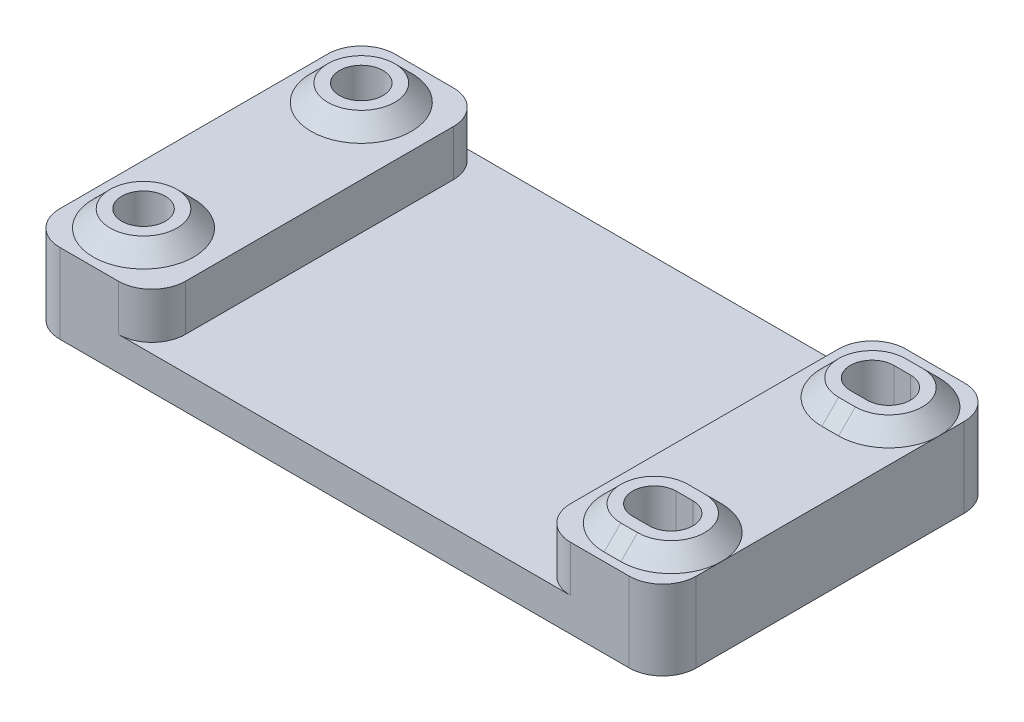
from build123d import *

# Parameters (mm, degrees)
SKETCH1_W           = 76
SKETCH1_H           = 40
SKETCH1_R           = 2.6
BOSS_EXTRUDE1_DEPTH = 4
SKETCH2_W           = 15
SKETCH2_H           = 40
SKETCH2_R           = 2.6
BOSS_EXTRUDE2_DEPTH = 5.5
SKETCH3_R           = 4
SKETCH3_R_2         = 2.6
BOSS_EXTRUDE3_DEPTH = 2
CHAMFER1_SIZE       = 2
FILLET1_R           = 4


with BuildPart() as part:
    # Sketch1 → Boss-Extrude1 (new body)
    with BuildSketch(Plane(origin=(0, 0, 0), x_dir=(1, 0, 0), z_dir=(0, 1, 0))):
        Rectangle(SKETCH1_W, SKETCH1_H)
        with Locations(Location((-31, -13, 0), (0, 0, 270))):
            Circle(SKETCH1_R, mode=Mode.SUBTRACT)
        with Locations(Location((-31, 13, 0), (0, 0, 270))):
            Circle(SKETCH1_R, mode=Mode.SUBTRACT)
        with BuildLine():
            Line((30, 15.6), (32, 15.6))
            ThreePointArc((32, 15.6), (34.6, 13), (32, 10.4))
            Line((32, 10.4), (30, 10.4))
            ThreePointArc((30, 10.4), (27.4, 13), (30, 15.6))
        make_face(mode=Mode.SUBTRACT)
        with BuildLine():
            Line((32, -10.4), (30, -10.4))
            ThreePointArc((30, -10.4), (27.4, -13), (30, -15.6))
            Line((30, -15.6), (32, -15.6))
            ThreePointArc((32, -15.6), (34.6, -13), (32, -10.4))
        make_face(mode=Mode.SUBTRACT)
    extrude(amount=BOSS_EXTRUDE1_DEPTH)

    # Sketch2 → Boss-Extrude2 (add)
    # profile 1 of 2: a face of its own
    with BuildSketch(Plane(origin=(0, 4, 0), x_dir=(1, 0, 0), z_dir=(0, 1, 0))):
        with Locations((30.5, 0)):
            Rectangle(SKETCH2_W, SKETCH2_H)
        with BuildLine():
            ThreePointArc((30, -15.6), (27.4, -13), (30, -10.4))
            Line((30, -10.4), (32, -10.4))
            ThreePointArc((32, -10.4), (34.6, -13), (32, -15.6))
            Line((32, -15.6), (30, -15.6))
        make_face(mode=Mode.SUBTRACT)
        with BuildLine():
            ThreePointArc((30, 10.4), (27.4, 13), (30, 15.6))
            Line((30, 15.6), (32, 15.6))
            ThreePointArc((32, 15.6), (34.6, 13), (32, 10.4))
            Line((32, 10.4), (30, 10.4))
        make_face(mode=Mode.SUBTRACT)
    # profile 2 of 2: a face of its own
    with BuildSketch(Plane(origin=(0, 4, 0), x_dir=(1, 0, 0), z_dir=(0, 1, 0))):
        with Locations((-30.5, 0)):
            Rectangle(SKETCH2_W, SKETCH2_H)
        with Locations((-31, -13)):
            Circle(SKETCH2_R, mode=Mode.SUBTRACT)
        with Locations((-31, 13)):
            Circle(SKETCH2_R, mode=Mode.SUBTRACT)
    extrude(amount=BOSS_EXTRUDE2_DEPTH)

    # Sketch3 → Boss-Extrude3 (add)
    # profile 1 of 4: a face of its own
    with BuildSketch(Plane(origin=(0, 9.5, 0), x_dir=(1, 0, 0), z_dir=(0, 1, 0))):
        with Locations(Location((-31, 13, 0), (0, 0, 270))):
            Circle(SKETCH3_R)
        with Locations(Location((-31, 13, 0), (0, 0, 270))):
            Circle(SKETCH3_R_2, mode=Mode.SUBTRACT)
    # profile 2 of 4: a face of its own
    with BuildSketch(Plane(origin=(0, 9.5, 0), x_dir=(1, 0, 0), z_dir=(0, 1, 0))):
        with Locations(Location((-31, -13, 0), (0, 0, 270))):
            Circle(SKETCH3_R)
        with Locations(Location((-31, -13, 0), (0, 0, 270))):
            Circle(SKETCH3_R_2, mode=Mode.SUBTRACT)
    # profile 3 of 4: a face of its own
    with BuildSketch(Plane(origin=(0, 9.5, 0), x_dir=(1, 0, 0), z_dir=(0, 1, 0))):
        with BuildLine():
            Line((32, 17), (30, 17))
            ThreePointArc((30, 17), (26, 13), (30, 9))
            Line((30, 9), (32, 9))
            ThreePointArc((32, 9), (36, 13), (32, 17))
        make_face()
        with BuildLine():
            Line((30, 15.6), (32, 15.6))
            ThreePointArc((32, 15.6), (34.6, 13), (32, 10.4))
            Line((32, 10.4), (30, 10.4))
            ThreePointArc((30, 10.4), (27.4, 13), (30, 15.6))
        make_face(mode=Mode.SUBTRACT)
    # profile 4 of 4: a face of its own
    with BuildSketch(Plane(origin=(0, 9.5, 0), x_dir=(1, 0, 0), z_dir=(0, 1, 0))):
        with BuildLine():
            Line((32, -9), (30, -9))
            ThreePointArc((30, -9), (26, -13), (30, -17))
            Line((30, -17), (32, -17))
            ThreePointArc((32, -17), (36, -13), (32, -9))
        make_face()
        with BuildLine():
            Line((32, -10.4), (30, -10.4))
            ThreePointArc((30, -10.4), (27.4, -13), (30, -15.6))
            Line((30, -15.6), (32, -15.6))
            ThreePointArc((32, -15.6), (34.6, -13), (32, -10.4))
        make_face(mode=Mode.SUBTRACT)
    extrude(amount=BOSS_EXTRUDE3_DEPTH)

    # Chamfer1
    chamfer1_edges = [part.edges().sort_by_distance(p)[0] for p in [
        (-31, 9.5, 9),
        (-31, 9.5, -17),
        (31, 9.5, -17),
        (26, 9.5, -13),
        (31, 9.5, -9),
        (36, 9.5, -13),
        (31, 9.5, 9),
        (26, 9.5, 13),
        (36, 9.5, 13),
        (31, 9.5, 17),
    ]]
    chamfer(chamfer1_edges, length=CHAMFER1_SIZE - 0.0001)  # a hair under: the kernel refuses the full size

    # Fillet1
    fillet1_edges = [part.edges().sort_by_distance(p)[0] for p in [
        (38, 4.75, 20),
        (-38, 4.75, 20),
        (-38, 4.75, -20),
        (38, 4.75, -20),
        (-23, 6.75, 20),
        (-23, 6.75, -20),
        (23, 6.75, -20),
        (23, 6.75, 20),
    ]]
    fillet(fillet1_edges, radius=FILLET1_R)


solid = part.part
